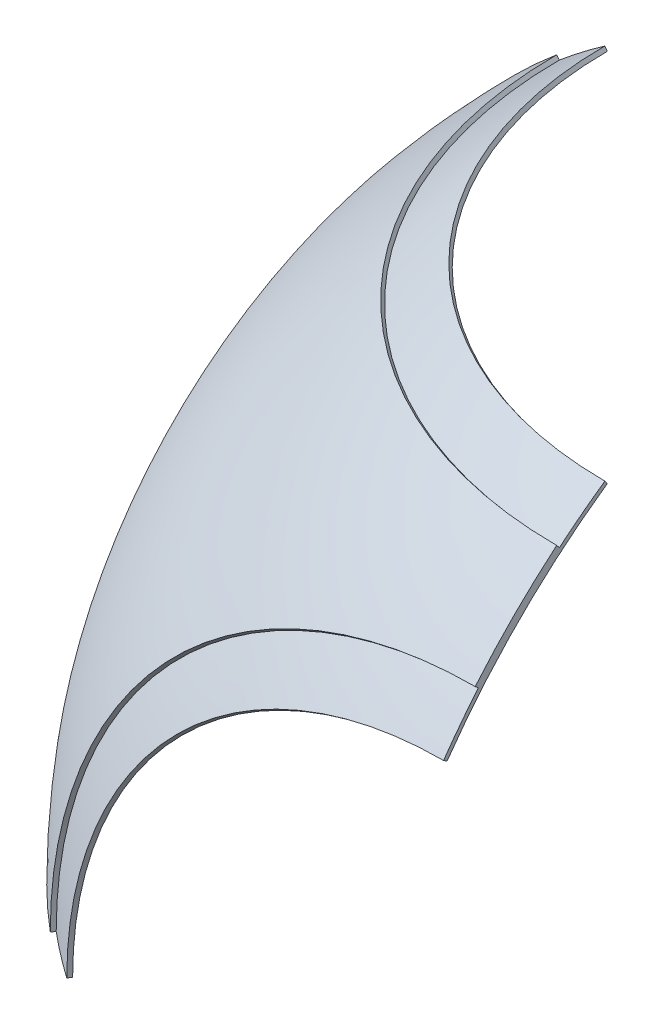
from build123d import *

# Parameters (mm, degrees)
REVOLVE1_ANGLE = 90


with BuildPart() as part:
    # Sketch1 → Revolve1 (revolve)
    with BuildSketch(Plane.XY):
        with BuildLine():
            Line((-250, 0), (-246.825, 0))
            ThreePointArc((-246.825, 0), (-218.936448899, 113.971101462), (-141.573003902, 202.187203332))
            Line((-141.573003902, 202.187203332), (-142.483556495, 203.487607202))
            ThreePointArc((-142.483556495, 203.487607202), (-151.223948484, 197.078886645), (-159.676477091, 190.295015226))
            Line((-159.676477091, 190.295015226), (-160.696902422, 191.51111078))
            ThreePointArc((-160.696902422, 191.51111078), (-226.576946759, 105.654565435), (-250, 0))
        make_face()
    revolve(axis=Axis((0, 0, 0), (0, 1, 0)), revolution_arc=REVOLVE1_ANGLE)

    # Sketch3 → Cut-Revolve1 (revolve, cut)
    with BuildSketch(Plane(origin=(0, 0, 0), x_dir=(0, 0, -1), z_dir=(1, 0, 0))):
        with BuildLine():
            Line((-246.825, 0), (-250, 0))
            ThreePointArc((-250, 0), (-234.923155196, 85.505035831), (-191.51111078, 160.696902422))
            Line((-191.51111078, 160.696902422), (-190.295015226, 159.676477091))
            ThreePointArc((-190.295015226, 159.676477091), (-197.078886645, 151.223948484), (-203.487607202, 142.483556495))
            Line((-203.487607202, 142.483556495), (-202.187203332, 141.573003902))
            ThreePointArc((-202.187203332, 141.573003902), (-235.401186368, 74.221708963), (-246.825, 0))
        make_face()
    revolve(axis=Axis((0, 0, 246.825), (0, 0, 1)), mode=Mode.SUBTRACT)

    # Sketch4 → Cut-Revolve2 (revolve, cut)
    with BuildSketch(Plane(origin=(0, 0, 0), x_dir=(-1, 0, 0), z_dir=(0, 0, -1))):
        with BuildLine():
            Line((246.825, 0), (250, 0))
            ThreePointArc((250, 0), (234.923155196, 85.505035831), (191.51111078, 160.696902422))
            Line((191.51111078, 160.696902422), (190.295015226, 159.676477091))
            ThreePointArc((190.295015226, 159.676477091), (197.078886645, 151.223948484), (203.487607202, 142.483556495))
            Line((203.487607202, 142.483556495), (202.187203332, 141.573003902))
            ThreePointArc((202.187203332, 141.573003902), (235.401186368, 74.221708963), (246.825, 0))
        make_face()
    revolve(axis=Axis((-246.825, 0, 0), (-1, 0, 0)), mode=Mode.SUBTRACT)


solid = part.part
